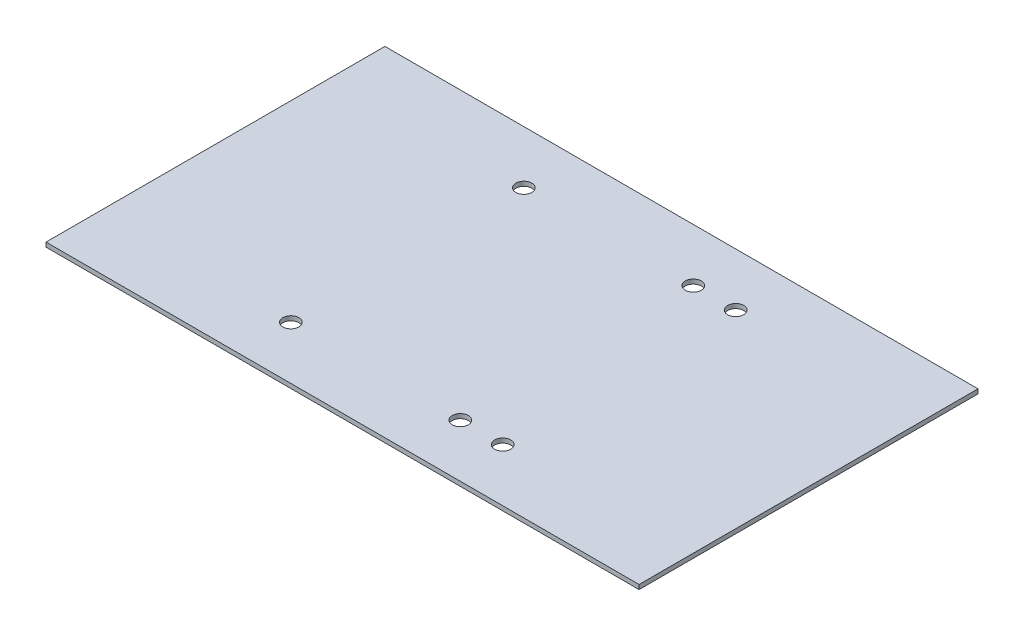
from build123d import *

# Parameters (mm, degrees)
SKETCH1_W          = 355.6
SKETCH1_H          = 203.2
BASE_FLANGE1_DEPTH = 2.65684
SKETCH8_R          = 4.826
CUT_EXTRUDE1_DEPTH = 410.571311006


# Sheet-metal steps are written as plain solids
with BuildPart() as part:
    # Sketch1 → Base-Flange1 (new body)
    with BuildSketch(Plane(origin=(0, 0, 0), x_dir=(1, 0, 0), z_dir=(0, 1, 0))):
        with Locations((177.8, 101.6)):
            Rectangle(SKETCH1_W, SKETCH1_H)
    extrude(amount=-BASE_FLANGE1_DEPTH)

    # Sketch8 → Cut-Extrude1 (cut, through all)
    with BuildSketch(Plane(origin=(0, 0, 0), x_dir=(1, 0, 0), z_dir=(0, 1, 0))):
        with Locations(Location((115.062, 171.45, 0), (0, 0, 270))):
            Circle(SKETCH8_R)
        with Locations(Location((216.662, 171.45, 0), (0, 0, 270))):
            Circle(SKETCH8_R)
        with Locations(Location((242.062, 171.45, 0), (0, 0, 270))):
            Circle(SKETCH8_R)
        with Locations(Location((242.062, 31.75, 0), (0, 0, 270))):
            Circle(SKETCH8_R)
        with Locations(Location((216.662, 31.75, 0), (0, 0, 270))):
            Circle(SKETCH8_R)
        with Locations(Location((115.062, 31.75, 0), (0, 0, 270))):
            Circle(SKETCH8_R)
    extrude(amount=-CUT_EXTRUDE1_DEPTH, mode=Mode.SUBTRACT)


solid = part.part
